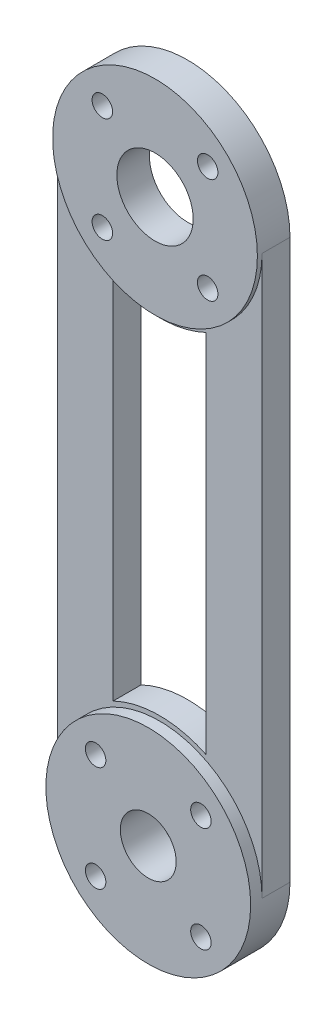
from build123d import *

# Parameters (mm, degrees)
BOSS_EXTRUDE1_DEPTH           = 3
BOSS_EXTRUDE2_START           = -0.5
SKETCH1_3_R                   = 11
BOSS_EXTRUDE2_DEPTH           = 0.5
SKETCH2_R                     = 4.1
SKETCH2_R_2                   = 1.1000000000000099
CUT_EXTRUDE1_DEPTH            = 3.5
SKETCH2_3_R                   = 2.000000000000007
CUT_EXTRUDE2_DEPTH            = 0.5
CIRPATTERN2_COUNT             = 4
BOSS_EXTRUDE3_START           = -1.225
SKETCH1_5_R                   = 11
BOSS_EXTRUDE3_DEPTH           = 1.225
SKETCH3_R                     = 3.0000000000000004
SKETCH3_R_2                   = 1.1
CUT_EXTRUDE3_DEPTH            = 4.225
SKETCH3_3_R                   = 2.0000000000000027
CUT_EXTRUDE4_DEPTH            = 1.225
CIRPATTERN3_COUNT             = 4
BODY_MOVE_COPY1_START         = -3
BODY_MOVE_COPY1_OUTLINE_R     = 2
BODY_MOVE_COPY1_OUTLINE_R_2   = 3
BODY_MOVE_COPY1_OUTLINE_R_3   = 4.1
BODY_MOVE_COPY1_DEPTH         = 3
BODY_MOVE_COPY1_START_2       = -2.5
BODY_MOVE_COPY1_2_OUTLINE_R   = 2
BODY_MOVE_COPY1_2_OUTLINE_R_2 = 1.1
BODY_MOVE_COPY1_2_DEPTH       = 2
BODY_MOVE_COPY1_START_3       = -1.775
BODY_MOVE_COPY1_3_OUTLINE_R   = 2
BODY_MOVE_COPY1_3_OUTLINE_R_2 = 1.1
BODY_MOVE_COPY1_3_DEPTH       = 0.55
BODY_MOVE_COPY1_START_4       = 0.5
BODY_MOVE_COPY1_4_OUTLINE_R   = 4.1
BODY_MOVE_COPY1_4_OUTLINE_R_2 = 1.1
BODY_MOVE_COPY1_4_DEPTH       = 2.5
BODY_MOVE_COPY1_START_5       = 1.225
BODY_MOVE_COPY1_5_OUTLINE_R   = 11
BODY_MOVE_COPY1_5_OUTLINE_R_2 = 3
BODY_MOVE_COPY1_5_OUTLINE_R_3 = 1.1
BODY_MOVE_COPY1_5_DEPTH       = 1.775
BODY_MOVE_COPY1_6_DEPTH       = 0.5


# Read off the part's stored shape, not the designer's step: Body-Move/Copy1
with BuildPart() as part:
    # Sketch1 → Boss-Extrude1 (new body)
    with BuildSketch(Plane.XY):
        with BuildLine():
            Line((-11.000000000000004, 30), (-11, -30))
            ThreePointArc((-11, -30), (-2.02e-15, -41), (11, -30.000000000000004))
            Line((11, -30), (10.999999999999996, 30))
            ThreePointArc((10.999999999999996, 30), (-5.6e-16, 41), (-11.000000000000004, 30.000000000000007))
        make_face()
        with BuildLine():
            ThreePointArc((4.999999999999998, -19.643842411396), (2.89e-15, -18.49999999999999), (-4.999999999999995, -19.643842411396))
            Line((-4.999999999999993, -19.643842411396008), (-5.0000000000000036, 19.643842411396008))
            ThreePointArc((-5.000000000000004, 19.643842411396008), (1.78e-15, 18.5), (5.000000000000006, 19.643842411396008))
            Line((5.0000000000000036, 19.643842411396008), (4.999999999999998, -19.643842411396008))
        make_face(mode=Mode.SUBTRACT)
    extrude(amount=BOSS_EXTRUDE1_DEPTH)

    # Sketch1<3> → Boss-Extrude2 (add)
    with BuildSketch(Plane.XY.offset(BOSS_EXTRUDE2_START)):
        with Locations((-3.67e-15, 30)):
            Circle(SKETCH1_3_R)
    extrude(amount=BOSS_EXTRUDE2_DEPTH)

    # Sketch2 → Cut-Extrude1 (cut)
    with BuildSketch(Plane.XY.offset(3)):
        with Locations((-3.67e-15, 30)):
            Circle(SKETCH2_R)
        with Locations((5.6568542494923415, 35.656854249492405)):
            Circle(SKETCH2_R_2)
    cut_extrude1 = extrude(amount=-CUT_EXTRUDE1_DEPTH, mode=Mode.SUBTRACT)

    # Sketch2<3> → Cut-Extrude2 (cut)
    with BuildSketch(Plane.XY.offset(3)):
        with Locations((5.6568542494923415, 35.656854249492405)):
            Circle(SKETCH2_3_R)
    cut_extrude2 = extrude(amount=-CUT_EXTRUDE2_DEPTH, mode=Mode.SUBTRACT)

    # CirPattern2: Cut-Extrude1, Cut-Extrude2 ×4 about axis
    cirpattern2_axis = Axis((-1.339e-14, 30.00000000000001, 0), (0, 0, 1))
    add([cut_extrude1.rotate(cirpattern2_axis, i * 360 / CIRPATTERN2_COUNT) for i in range(1, CIRPATTERN2_COUNT)], mode=Mode.SUBTRACT)
    add([cut_extrude2.rotate(cirpattern2_axis, i * 360 / CIRPATTERN2_COUNT) for i in range(1, CIRPATTERN2_COUNT)], mode=Mode.SUBTRACT)

    # Sketch1<5> → Boss-Extrude3 (add)
    with BuildSketch(Plane.XY.offset(BOSS_EXTRUDE3_START)):
        with Locations((0, -30)):
            Circle(SKETCH1_5_R)
    extrude(amount=BOSS_EXTRUDE3_DEPTH)

    # Sketch3 → Cut-Extrude3 (cut)
    with BuildSketch(Plane.XY.offset(3)):
        with Locations((0, -30)):
            Circle(SKETCH3_R)
        with Locations((5.656854249492389, -24.34314575050763)):
            Circle(SKETCH3_R_2)
    cut_extrude3 = extrude(amount=-CUT_EXTRUDE3_DEPTH, mode=Mode.SUBTRACT)

    # Sketch3<3> → Cut-Extrude4 (cut)
    with BuildSketch(Plane.XY.offset(3)):
        with Locations((5.656854249492389, -24.34314575050763)):
            Circle(SKETCH3_3_R)
    cut_extrude4 = extrude(amount=-CUT_EXTRUDE4_DEPTH, mode=Mode.SUBTRACT)

    # CirPattern3: Cut-Extrude3, Cut-Extrude4 ×4 about axis
    cirpattern3_axis = Axis((-9.49e-15, -29.99999999999999, 0), (0, 0, 1))
    add([cut_extrude3.rotate(cirpattern3_axis, i * 360 / CIRPATTERN3_COUNT) for i in range(1, CIRPATTERN3_COUNT)], mode=Mode.SUBTRACT)
    add([cut_extrude4.rotate(cirpattern3_axis, i * 360 / CIRPATTERN3_COUNT) for i in range(1, CIRPATTERN3_COUNT)], mode=Mode.SUBTRACT)

    # Body-Move/Copy1 outline → Body-Move/Copy1 (add)
    with BuildSketch(Plane.XY.offset(BODY_MOVE_COPY1_START)):
        with BuildLine():
            Line((-11, 30), (-11, -30))
            ThreePointArc((-11, -30), (0, -41), (11, -30))
            Line((11, -30), (11, 30))
            ThreePointArc((11, 30), (0, 41), (-11, 30))
        make_face()
        with BuildLine():
            Line((-5, -19.643842411), (-5, 19.643842411))
            ThreePointArc((-5, 19.643842411), (0, 18.5), (5, 19.643842411))
            Line((5, 19.643842411), (5, -19.643842411))
            ThreePointArc((5, -19.643842411), (0, -18.5), (-5, -19.643842411))
        make_face(mode=Mode.SUBTRACT)
        with Locations((5.656854249, -24.343145751)):
            Circle(BODY_MOVE_COPY1_OUTLINE_R, mode=Mode.SUBTRACT)
        with Locations((-5.656854249, -35.656854249)):
            Circle(BODY_MOVE_COPY1_OUTLINE_R, mode=Mode.SUBTRACT)
        with Locations((-5.656854249, -24.343145751)):
            Circle(BODY_MOVE_COPY1_OUTLINE_R, mode=Mode.SUBTRACT)
        with Locations((0, -30)):
            Circle(BODY_MOVE_COPY1_OUTLINE_R_2, mode=Mode.SUBTRACT)
        with Locations((5.656854249, -35.656854249)):
            Circle(BODY_MOVE_COPY1_OUTLINE_R, mode=Mode.SUBTRACT)
        with Locations((5.656854249, 35.656854249)):
            Circle(BODY_MOVE_COPY1_OUTLINE_R, mode=Mode.SUBTRACT)
        with Locations((-5.656854249, 24.343145751)):
            Circle(BODY_MOVE_COPY1_OUTLINE_R, mode=Mode.SUBTRACT)
        with Locations((-5.656854249, 35.656854249)):
            Circle(BODY_MOVE_COPY1_OUTLINE_R, mode=Mode.SUBTRACT)
        with Locations((0, 30)):
            Circle(BODY_MOVE_COPY1_OUTLINE_R_3, mode=Mode.SUBTRACT)
        with Locations((5.656854249, 24.343145751)):
            Circle(BODY_MOVE_COPY1_OUTLINE_R, mode=Mode.SUBTRACT)
    extrude(amount=BODY_MOVE_COPY1_DEPTH)

    # Body-Move_Copy1 2 outline → Body-Move_Copy1 2 (add)
    # profile 1 of 4: a face of its own
    with BuildSketch(Plane.XY.offset(BODY_MOVE_COPY1_START_2)):
        with Locations((5.656854249, 35.656854249)):
            Circle(BODY_MOVE_COPY1_2_OUTLINE_R)
        with Locations((5.656854249, 35.656854249)):
            Circle(BODY_MOVE_COPY1_2_OUTLINE_R_2, mode=Mode.SUBTRACT)
    # profile 2 of 4: a face of its own
    with BuildSketch(Plane.XY.offset(BODY_MOVE_COPY1_START_2)):
        with Locations((5.656854249, 24.343145751)):
            Circle(BODY_MOVE_COPY1_2_OUTLINE_R)
        with Locations((5.656854249, 24.343145751)):
            Circle(BODY_MOVE_COPY1_2_OUTLINE_R_2, mode=Mode.SUBTRACT)
    # profile 3 of 4: a face of its own
    with BuildSketch(Plane.XY.offset(BODY_MOVE_COPY1_START_2)):
        with Locations((-5.656854249, 35.656854249)):
            Circle(BODY_MOVE_COPY1_2_OUTLINE_R)
        with Locations((-5.656854249, 35.656854249)):
            Circle(BODY_MOVE_COPY1_2_OUTLINE_R_2, mode=Mode.SUBTRACT)
    # profile 4 of 4: a face of its own
    with BuildSketch(Plane.XY.offset(BODY_MOVE_COPY1_START_2)):
        with Locations((-5.656854249, 24.343145751)):
            Circle(BODY_MOVE_COPY1_2_OUTLINE_R)
        with Locations((-5.656854249, 24.343145751)):
            Circle(BODY_MOVE_COPY1_2_OUTLINE_R_2, mode=Mode.SUBTRACT)
    extrude(amount=BODY_MOVE_COPY1_2_DEPTH)

    # Body-Move_Copy1 3 outline → Body-Move_Copy1 3 (add)
    # profile 1 of 4: a face of its own
    with BuildSketch(Plane.XY.offset(BODY_MOVE_COPY1_START_3)):
        with Locations((5.656854249, -24.343145751)):
            Circle(BODY_MOVE_COPY1_3_OUTLINE_R)
        with Locations((5.656854249, -24.343145751)):
            Circle(BODY_MOVE_COPY1_3_OUTLINE_R_2, mode=Mode.SUBTRACT)
    # profile 2 of 4: a face of its own
    with BuildSketch(Plane.XY.offset(BODY_MOVE_COPY1_START_3)):
        with Locations((5.656854249, -35.656854249)):
            Circle(BODY_MOVE_COPY1_3_OUTLINE_R)
        with Locations((5.656854249, -35.656854249)):
            Circle(BODY_MOVE_COPY1_3_OUTLINE_R_2, mode=Mode.SUBTRACT)
    # profile 3 of 4: a face of its own
    with BuildSketch(Plane.XY.offset(BODY_MOVE_COPY1_START_3)):
        with Locations((-5.656854249, -24.343145751)):
            Circle(BODY_MOVE_COPY1_3_OUTLINE_R)
        with Locations((-5.656854249, -24.343145751)):
            Circle(BODY_MOVE_COPY1_3_OUTLINE_R_2, mode=Mode.SUBTRACT)
    # profile 4 of 4: a face of its own
    with BuildSketch(Plane.XY.offset(BODY_MOVE_COPY1_START_3)):
        with Locations((-5.656854249, -35.656854249)):
            Circle(BODY_MOVE_COPY1_3_OUTLINE_R)
        with Locations((-5.656854249, -35.656854249)):
            Circle(BODY_MOVE_COPY1_3_OUTLINE_R_2, mode=Mode.SUBTRACT)
    extrude(amount=BODY_MOVE_COPY1_3_DEPTH)

    # Body-Move_Copy1 4 outline → Body-Move_Copy1 4 (cut)
    with BuildSketch(Plane.XY.offset(BODY_MOVE_COPY1_START_4)):
        with BuildLine():
            ThreePointArc((-11, -30), (0, -19), (11, -30))
            Line((11, -30), (11, 30))
            ThreePointArc((11, 30), (0, 41), (-11, 30))
            Line((-11, 30), (-11, -30))
        make_face()
        with BuildLine():
            Line((-5, -19.643842411), (-5, 19.643842411))
            ThreePointArc((-5, 19.643842411), (0, 18.5), (5, 19.643842411))
            Line((5, 19.643842411), (5, -19.643842411))
            ThreePointArc((5, -19.643842411), (0, -18.5), (-5, -19.643842411))
        make_face(mode=Mode.SUBTRACT)
        with Locations((0, 30)):
            Circle(BODY_MOVE_COPY1_4_OUTLINE_R, mode=Mode.SUBTRACT)
        with Locations((5.656854249, 35.656854249)):
            Circle(BODY_MOVE_COPY1_4_OUTLINE_R_2, mode=Mode.SUBTRACT)
        with Locations((-5.656854249, 24.343145751)):
            Circle(BODY_MOVE_COPY1_4_OUTLINE_R_2, mode=Mode.SUBTRACT)
        with Locations((-5.656854249, 35.656854249)):
            Circle(BODY_MOVE_COPY1_4_OUTLINE_R_2, mode=Mode.SUBTRACT)
        with Locations((5.656854249, 24.343145751)):
            Circle(BODY_MOVE_COPY1_4_OUTLINE_R_2, mode=Mode.SUBTRACT)
    extrude(amount=BODY_MOVE_COPY1_4_DEPTH, mode=Mode.SUBTRACT)

    # Body-Move_Copy1 5 outline → Body-Move_Copy1 5 (cut)
    with BuildSketch(Plane.XY.offset(BODY_MOVE_COPY1_START_5)):
        with Locations((0, -30)):
            Circle(BODY_MOVE_COPY1_5_OUTLINE_R)
        with Locations((0, -30)):
            Circle(BODY_MOVE_COPY1_5_OUTLINE_R_2, mode=Mode.SUBTRACT)
        with Locations((-5.656854249, -35.656854249)):
            Circle(BODY_MOVE_COPY1_5_OUTLINE_R_3, mode=Mode.SUBTRACT)
        with Locations((-5.656854249, -24.343145751)):
            Circle(BODY_MOVE_COPY1_5_OUTLINE_R_3, mode=Mode.SUBTRACT)
        with Locations((5.656854249, -35.656854249)):
            Circle(BODY_MOVE_COPY1_5_OUTLINE_R_3, mode=Mode.SUBTRACT)
        with Locations((5.656854249, -24.343145751)):
            Circle(BODY_MOVE_COPY1_5_OUTLINE_R_3, mode=Mode.SUBTRACT)
    extrude(amount=BODY_MOVE_COPY1_5_DEPTH, mode=Mode.SUBTRACT)

    # Body-Move_Copy1 6 outline → Body-Move_Copy1 6 (cut)
    with BuildSketch(Plane.XY):
        with BuildLine():
            ThreePointArc((-11, -30), (0, -19), (11, -30))
            Line((11, -30), (11, 30))
            ThreePointArc((11, 30), (0, 19), (-11, 30))
            Line((-11, 30), (-11, -30))
        make_face()
        with BuildLine():
            Line((-5, -19.643842411), (-5, 19.643842411))
            ThreePointArc((-5, 19.643842411), (0, 18.5), (5, 19.643842411))
            Line((5, 19.643842411), (5, -19.643842411))
            ThreePointArc((5, -19.643842411), (0, -18.5), (-5, -19.643842411))
        make_face(mode=Mode.SUBTRACT)
    extrude(amount=BODY_MOVE_COPY1_6_DEPTH, mode=Mode.SUBTRACT)


solid = part.part
